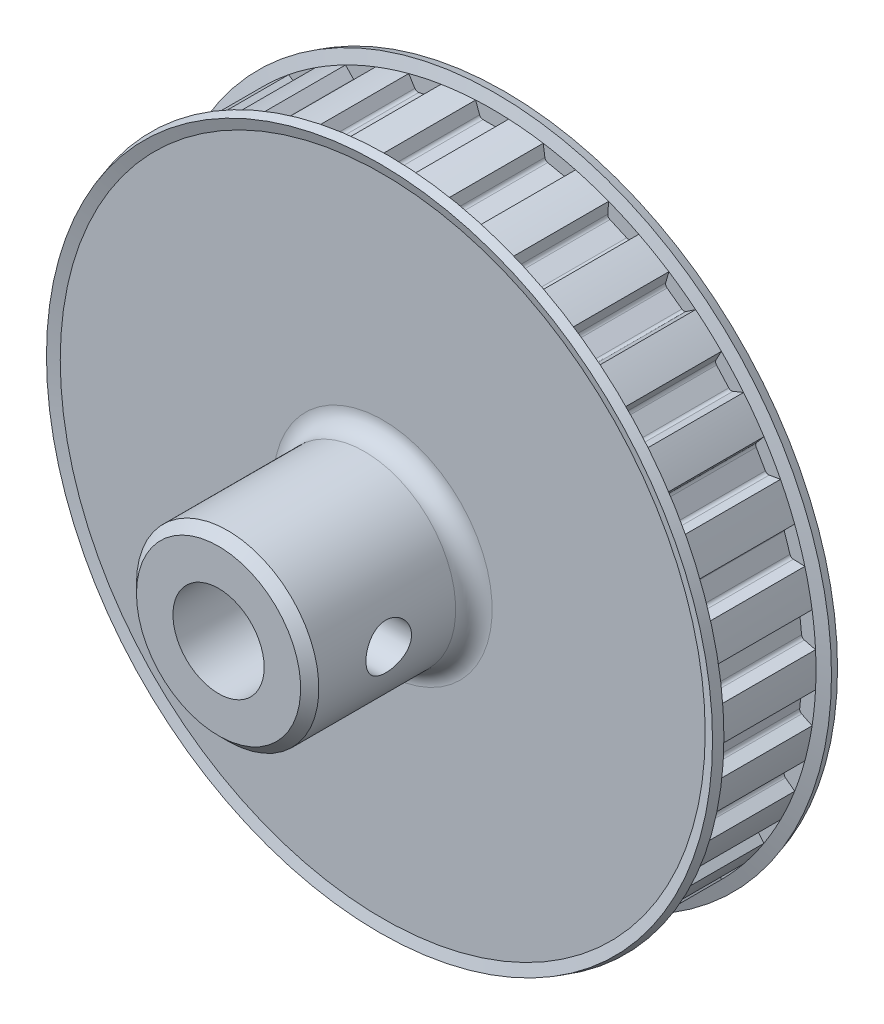
from build123d import *

# Parameters (mm, degrees)
SKETCH1_R               = 45.0977
BASEPULLEY_DEPTH        = 13.97
GROOVE_DEPTH            = 6.985
GROOVES_COUNT           = 30
GROOVES_ANGLE           = 348
SKETCH4_W               = 24.13
SKETCH4_H               = 12.7
BORSKE_R                = 6.35
BORE_DEPTH              = 78.178080042
CUT_EXTRUDE1_DEPTH      = 71.378539367
CUT_EXTRUDE1_DEPTH_BACK = 71.378539367
SKETCH5_R               = 3.175
FILLET1_R               = 2.54
CHAMFER1_SIZE           = 1.27


with BuildPart() as part:
    # Sketch1 → BasePulley (new body)
    with BuildSketch(Plane.XY):
        Circle(SKETCH1_R)
    extrude(amount=-BASEPULLEY_DEPTH)

    # Sketch2 → Flange (revolve)
    with BuildSketch(Plane(origin=(0, 0, 0), x_dir=(0, 0, -1), z_dir=(1, 0, 0))):
        Polygon((13.97, 45.0977), (14.474761355, 46.7487), (15.689268395, 46.377387935), (15.24, 44.907897228), (15.24, 0), (-1.27, 0), (-1.27, 44.907897228), (-1.719268395, 46.377387935), (-0.504761355, 46.7487), (0, 45.0977), align=None)
    revolve(axis=Axis((0, 0, 0), (0, 0, -1)))

    # Sketch3 → Groove (cut, symmetric)
    with BuildSketch(Plane.XY.offset(-6.985)):
        with BuildLine():
            Line((-2.3241, 45.0977), (-2.3241, 70.4977))
            Line((-2.3241, 70.4977), (2.3241, 70.4977))
            Line((2.3241, 70.4977), (2.3241, 45.0977))
            Line((2.3241, 45.0977), (1.752395126, 43.526953767))
            ThreePointArc((1.752395126, 43.526953767), (1.566408104, 43.284570762), (1.275031274, 43.1927))
            Line((1.275031274, 43.1927), (-1.275031274, 43.1927))
            ThreePointArc((-1.275031274, 43.1927), (-1.566408104, 43.284570762), (-1.752395126, 43.526953767))
            Line((-1.752395126, 43.526953767), (-2.3241, 45.0977))
        make_face()
    groove = extrude(amount=GROOVE_DEPTH, both=True, mode=Mode.SUBTRACT)

    # Grooves: Groove ×30 about axis
    grooves_axis = Axis((0, 0, -13.97), (0, 0, 1))
    for i in range(1, GROOVES_COUNT):
        add(groove.rotate(grooves_axis, i * GROOVES_ANGLE / (GROOVES_COUNT - 1)), mode=Mode.SUBTRACT)

    # Sketch4 → BaseHub (revolve)
    with BuildSketch(Plane(origin=(0, 0, 0), x_dir=(0, 0, -1), z_dir=(1, 0, 0))):
        with Locations((-12.065, 6.35)):
            Rectangle(SKETCH4_W, SKETCH4_H)
    revolve(axis=Axis((0, 0, 0), (0, 0, -1)))

    # BorSke → Bore (cut, through all)
    with BuildSketch(Plane.XY.offset(24.13)):
        Circle(BORSKE_R)
    extrude(amount=-BORE_DEPTH, mode=Mode.SUBTRACT)

    # Sketch5 → Cut-Extrude1 (cut, two sides: drawn at the far end of the back side and taken through both)
    with BuildSketch(Plane(origin=(0, 0, 0), x_dir=(0, 0, -1), z_dir=(1, 0, 0)).offset(-CUT_EXTRUDE1_DEPTH_BACK)):
        with Locations((-13.132528872, 0)):
            Circle(SKETCH5_R)
    extrude(amount=CUT_EXTRUDE1_DEPTH + CUT_EXTRUDE1_DEPTH_BACK, mode=Mode.SUBTRACT)

    # Fillet1
    fillet1_edges = [part.edges().sort_by_distance(p)[0] for p in [
        (0, -12.7, 1.27),
    ]]
    fillet(fillet1_edges, radius=FILLET1_R)

    # Chamfer1
    chamfer1_edges = [part.edges().sort_by_distance(p)[0] for p in [
        (0, -12.7, 24.13),
    ]]
    chamfer(chamfer1_edges, length=CHAMFER1_SIZE)


solid = part.part
